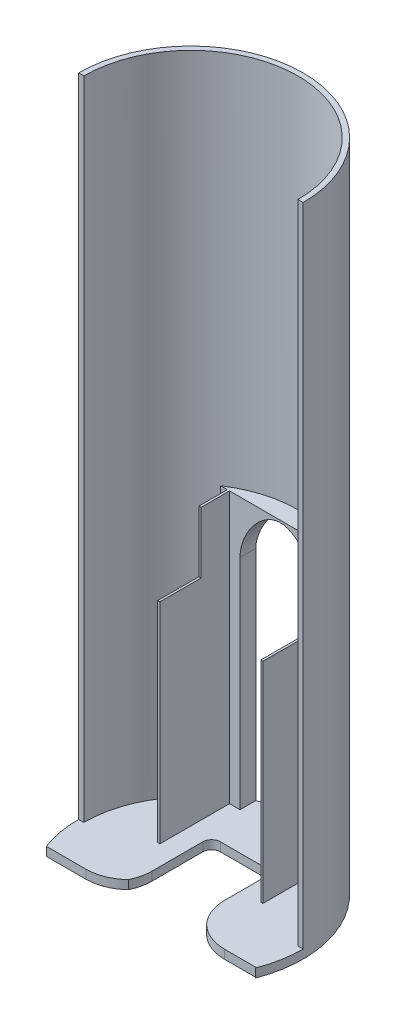
from build123d import *

# Parameters (mm, degrees)
SKETCH1_R               = 25.7
MAIN_CYLINDER_DEPTH     = 150
SKETCH4_R               = 24.5
MAIN_CUT_DOWN_DEPTH     = 148
SKETCH7_W               = 24.1
SKETCH7_H               = 31
FEATHER_BOX_DEPTH       = 62
FEATHER_HOLE_DEPTH      = 90
FEATHER_HOLE_DEPTH_BACK = 62
SKETCH8_W               = 23.1
SKETCH8_H               = 32
WINDOW_START            = 62
WINDOW_FILLER_DEPTH     = 62
SKETCH18_W              = 18.3
SKETCH18_H              = 50
WINDOW_CUT_DEPTH        = 16
SD_RESET_ACCESS_DEPTH   = 2
SKETCH26_W              = 0.5
SKETCH26_H              = 62
TRIM_DEPTH              = 15
FILLET3_R               = 10
SKETCH34_W              = 49.114786026
SKETCH34_H              = 17.457477886
CUT_EXTRUDE5_DEPTH      = 2
FILLET7_R               = 10
FILLET8_R               = 10
FILLET9_R               = 2
SKETCH28_W              = 2.4
SKETCH28_H              = 8
CUT_EXTRUDE6_DEPTH      = 10
FILLET10_R              = 10
FILLET11_R              = 2
SKETCH35_W              = 0.5
SKETCH35_H              = 9.444605522
CUT_EXTRUDE7_DEPTH      = 14


# Some blends are built 0.0001 mm under size
with BuildPart() as part:
    # Sketch1 → Main Cylinder (new body)
    with BuildSketch(Plane(origin=(0, 0, 0), x_dir=(1, 0, 0), z_dir=(0, 1, 0))):
        with Locations(Location((0, 0, 0), (0, 0, 270))):
            Circle(SKETCH1_R)
    extrude(amount=MAIN_CYLINDER_DEPTH)

    # Sketch4 → Main cut down (cut)
    with BuildSketch(Plane(origin=(0, 150, 0), x_dir=(1, 0, 0), z_dir=(0, 1, 0))):
        Circle(SKETCH4_R)
        Polygon((0, 0), (25.7, 0), (25.7, -40.6), (-25.7, -40.6), (-25.7, 0), align=None)
    extrude(amount=-MAIN_CUT_DOWN_DEPTH, mode=Mode.SUBTRACT)

    # Sketch7 → Feather box (add)
    with BuildSketch(Plane(origin=(0, 2, 0), x_dir=(1, 0, 0), z_dir=(0, 1, 0))):
        with Locations((0, 4.951216806)):
            Rectangle(SKETCH7_W, SKETCH7_H)
    extrude(amount=FEATHER_BOX_DEPTH)

    # Sketch8 → Feather hole (cut, two sides: drawn at the far end of the back side and taken through both)
    with BuildSketch(Plane(origin=(0, 64, 0), x_dir=(1, 0, 0), z_dir=(0, 1, 0)).offset(-FEATHER_HOLE_DEPTH_BACK)):
        with Locations((0, 4.451216806)):
            Rectangle(SKETCH8_W, SKETCH8_H)
    extrude(amount=FEATHER_HOLE_DEPTH + FEATHER_HOLE_DEPTH_BACK, mode=Mode.SUBTRACT)

    # Sketch15 → window filler (add)
    with BuildSketch(Plane(origin=(0, 2, 0), x_dir=(1, 0, 0), z_dir=(0, 1, 0)).offset(WINDOW_START)):
        with BuildLine():
            Line((-13.575571615, 20.394946809), (13.575571615, 20.394946809))
            ThreePointArc((13.575571615, 20.394946809), (0, 24.5), (-13.575571615, 20.394946809))
        make_face()
    extrude(amount=-WINDOW_FILLER_DEPTH)

    # Sketch18 → window cut (cut)
    with BuildSketch(Plane.XY.offset(-20.394946809)):
        with BuildLine():
            add(Edge.make_bspline(
                [(-9.15, 52), (-9.166701282, 56.998161016), (-0.16215998, 69.276496907), (8.559054188, 57.202948769), (9.892970994, 47.089830129), (-8.678000401, 46.988029764), (-9.148278475, 51.484802374), (-9.15, 52)],
                knots=[0, 0, 0, 0, 0.329948679, 0.626902491, 0.693907623, 0.965989736, 1, 1, 1, 1], degree=3))
        make_face()
        with Locations((0, 27)):
            Rectangle(SKETCH18_W, SKETCH18_H)
    extrude(amount=-WINDOW_CUT_DEPTH, mode=Mode.SUBTRACT)

    # Sketch23 → sd reset access (cut)
    with BuildSketch(Plane(origin=(0, 2, 0), x_dir=(1, 0, 0), z_dir=(0, 1, 0))):
        Polygon((-8.05, -11.21), (9.8, -11.21), (9.8, -6.21), (7.05, -6.21), (7.05, 11.79), (-7.05, 11.79), (-7.05, -6.21), (-8.05, -6.21), align=None)
    extrude(amount=-SD_RESET_ACCESS_DEPTH, mode=Mode.SUBTRACT)

    # Sketch26 → trim (cut)
    with BuildSketch(Plane.XY.offset(10.548783194)):
        with Locations((-11.8, 33)):
            Rectangle(SKETCH26_W, SKETCH26_H)
        with Locations((11.8, 33)):
            Rectangle(SKETCH26_W, SKETCH26_H)
    extrude(amount=-TRIM_DEPTH, mode=Mode.SUBTRACT)

    # Fillet3
    # the kernel refuses this fillet: 10 mm, written as the material it takes off along each edge
    with BuildSketch(Plane(origin=(-7.05, 12.897247359, 6.21), x_dir=(0, 0, -1), z_dir=(0, -1, 0))) as fillet3_piece_1:
        with BuildLine():
            CenterArc((4.358898944, -10), FILLET3_R, 90, 25.841932763)
            Line((0, -1), (-0.087177979, -0.82))
            ThreePointArc((-0.087177979, -0.82), (-0.2, -0.5), (-0.2, 0))
            Line((-0.2, 0), (0, 0.2))
            Line((0, 0.2), (4.358898944, 0.2))
            Line((4.358898944, 0.2), (4.358898944, 0))
        make_face()
    extrude(amount=23.794494718, mode=Mode.SUBTRACT)

    # Sketch34 → Cut-Extrude5 (cut)
    with BuildSketch(Plane(origin=(0, 2, 0), x_dir=(1, 0, 0), z_dir=(0, 1, 0))):
        with Locations((-0.549154382, -17.755029201)):
            Rectangle(SKETCH34_W, SKETCH34_H)
    extrude(amount=-CUT_EXTRUDE5_DEPTH, mode=Mode.SUBTRACT)

    # Fillet7
    # the kernel refuses this fillet: 10 mm, written as the material it takes off along each edge
    with BuildSketch(Plane(origin=(-8.05, 19.391505532, 9.026290258), x_dir=(-1, 0, 0), z_dir=(0, -1, 0))) as fillet7_piece_1:
        with BuildLine():
            CenterArc((6.956602213, 10), FILLET7_R, 225.920148316, 44.079851684)
            Line((0, 2.816290258), (-0.139132044, 2.672616063))
            ThreePointArc((-0.139132044, 2.672616063), (-0.2, 1.408145129), (-0.2, 0))
            Line((-0.2, 0), (0, -0.2))
            Line((0, -0.2), (6.956602213, -0.2))
            Line((6.956602213, -0.2), (6.956602213, 0))
        make_face()
    extrude(amount=36.783011063, mode=Mode.SUBTRACT)

    # Fillet8
    # the kernel refuses this fillet: 10 mm, written as the material it takes off along each edge
    with BuildSketch(Plane(origin=(9.8, -17.391505532, 9.026290258), x_dir=(1, 0, 0), z_dir=(0, 1, 0))) as fillet8_piece_1:
        with BuildLine():
            CenterArc((6.956602213, 10), FILLET8_R, 225.920148316, 44.079851684)
            Line((0, 2.816290258), (-0.139132044, 2.672616063))
            ThreePointArc((-0.139132044, 2.672616063), (-0.2, 1.408145129), (-0.2, 0))
            Line((-0.2, 0), (0, -0.2))
            Line((0, -0.2), (6.956602213, -0.2))
            Line((6.956602213, -0.2), (6.956602213, 0))
        make_face()
    extrude(amount=36.783011063, mode=Mode.SUBTRACT)
    with BuildSketch(Plane(origin=(7.05, 19.218721642, 6.21), x_dir=(1, 0, 0), z_dir=(0, -1, 0))) as fillet8_piece_2:
        with BuildLine():
            CenterArc((10, -6.887488657), FILLET8_R, 136.468847833, 43.531152167)
            Line((0, -6.887488657), (-0.2, -6.887488657))
            Line((-0.2, -6.887488657), (-0.2, 0))
            Line((-0.2, 0), (0, 0.2))
            ThreePointArc((0, 0.2), (1.375, 0.2), (2.605, 0.137749773))
            Line((2.605, 0.137749773), (2.75, 0))
        make_face()
    extrude(amount=36.437443285, mode=Mode.SUBTRACT)

    # Fillet9
    fillet9_edges = [part.edges().sort_by_distance(p)[0] for p in [
        (-7.05, 1, -11.79),
        (7.05, 1, -11.79),
    ]]
    fillet(fillet9_edges, radius=FILLET9_R)

    # Sketch28 → Cut-Extrude6 (cut)
    with BuildSketch(Plane.XY.offset(-20.394946809)):
        with Locations((10.35, 8)):
            Rectangle(SKETCH28_W, SKETCH28_H)
    extrude(amount=-CUT_EXTRUDE6_DEPTH, mode=Mode.SUBTRACT)

    # Fillet10
    # the kernel refuses this fillet: 10 mm, written as the material it takes off along each edge
    with BuildSketch(Plane(origin=(9.15, 12, -4.146869999), x_dir=(1, 0, 0), z_dir=(0, 0, -1))) as fillet10_piece_1:
        with BuildLine():
            CenterArc((10, -6.499230724), FILLET10_R, 139.464197889, 40.535802111)
            Line((0, -6.499230724), (-0.2, -6.499230724))
            Line((-0.2, -6.499230724), (-0.2, 0))
            Line((-0.2, 0), (0, 0.2))
            ThreePointArc((0, 0.2), (1.2, 0.2), (2.248, 0.129984614))
            Line((2.248, 0.129984614), (2.4, 0))
        make_face()
    extrude(amount=36.117191071, mode=Mode.SUBTRACT)

    # Fillet11
    fillet11_edges = [part.edges().sort_by_distance(p)[0] for p in [
        (9.15, 4, -22.205465534),
    ]]
    fillet(fillet11_edges, radius=FILLET11_R - 0.0001)  # a hair under: the kernel refuses the full size

    # Sketch35 → Cut-Extrude7 (cut)
    with BuildSketch(Plane(origin=(0, 64, 0), x_dir=(1, 0, 0), z_dir=(0, 1, 0))):
        with Locations((-11.8, 9.173519567)):
            Rectangle(SKETCH35_W, SKETCH35_H)
        with Locations((11.8, 9.173519567)):
            Rectangle(SKETCH35_W, SKETCH35_H)
    extrude(amount=-CUT_EXTRUDE7_DEPTH, mode=Mode.SUBTRACT)


solid = part.part
